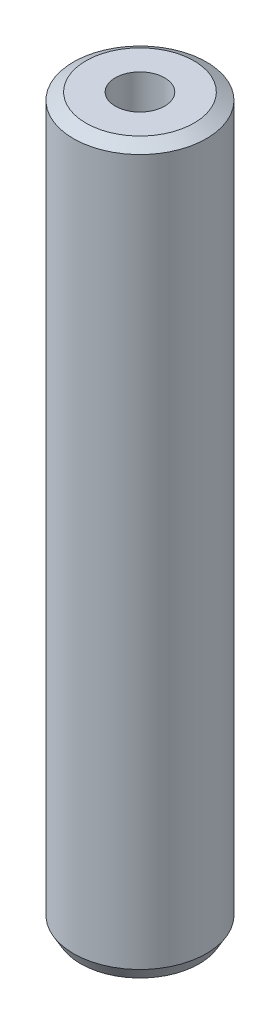
from build123d import *
from OCP.BRepFilletAPI import BRepFilletAPI_MakeChamfer

# Parameters (mm, degrees)
SKETCH1_R           = 55
BOSS_EXTRUDE1_DEPTH = 600
SKETCH2_R           = 20.379431542
CUT_EXTRUDE1_DEPTH  = 606.020660804
CHAMFER1_SIZE       = 5.961816451
CHAMFER1_SIZE2      = 10.326168998


with BuildPart() as part:
    # Sketch1 → Boss-Extrude1 (new body)
    with BuildSketch(Plane(origin=(0, 0, 0), x_dir=(1, 0, 0), z_dir=(0, 1, 0))):
        Circle(SKETCH1_R)
    extrude(amount=BOSS_EXTRUDE1_DEPTH)

    # Sketch2 → Cut-Extrude1 (cut, through all)
    with BuildSketch(Plane(origin=(0, 0, 0), x_dir=(1, 0, 0), z_dir=(0, 1, 0))):
        Circle(SKETCH2_R)
    extrude(amount=CUT_EXTRUDE1_DEPTH, mode=Mode.SUBTRACT)

    # Chamfer1: one chamfer whose edges measure the first distance from different faces: ONE call of the kernel's chamfer builder (chamfer() names one face for all edges)
    chamfer1_edges_1 = [part.edges().sort_by_distance(p)[0] for p in [
        (-55, 600, 0),
    ]]
    chamfer1_side_1 = [part.faces().sort_by_distance(p)[0] for p in [
        (-55, 300, 0),
    ]]
    chamfer1_edges_2 = [part.edges().sort_by_distance(p)[0] for p in [
        (-55, 0, 0),
    ]]
    chamfer1_side_2 = [part.faces().sort_by_distance(p)[0] for p in [
        (-53.444365081, 0, 0),
    ]]
    chamfer1 = BRepFilletAPI_MakeChamfer(part.part.solid().wrapped)
    for e in chamfer1_edges_1:
        chamfer1.Add(CHAMFER1_SIZE, CHAMFER1_SIZE2, e.wrapped, chamfer1_side_1[0].wrapped)  # the first distance lies on this face
    for e in chamfer1_edges_2:
        chamfer1.Add(CHAMFER1_SIZE, CHAMFER1_SIZE2, e.wrapped, chamfer1_side_2[0].wrapped)  # the first distance lies on this face
    add(Compound.cast(chamfer1.Shape()), mode=Mode.REPLACE)


solid = part.part
